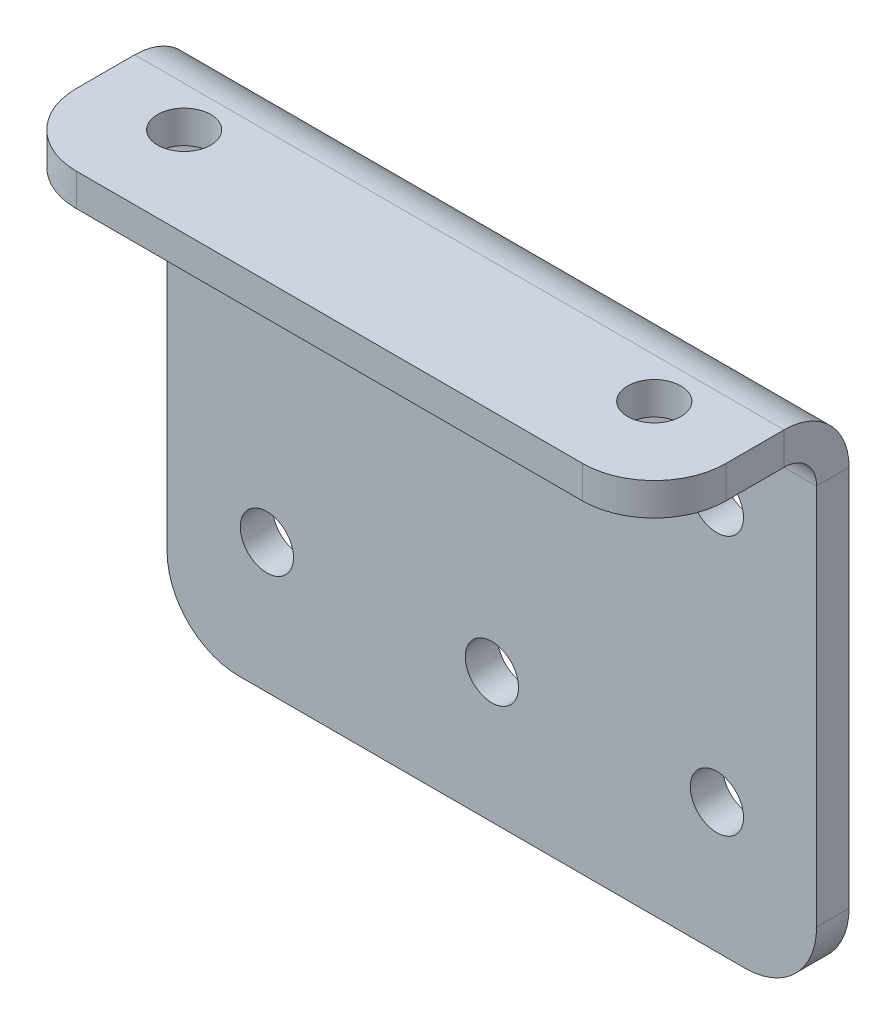
from build123d import *

# Parameters (mm, degrees)
SKETCH2_W              = 63.5
SKETCH2_H              = 50.679996867
BOSS_EXTRUDE1_DEPTH    = 3.175
SKETCH3_W              = 63.5
SKETCH3_H              = 19.05
BOSS_EXTRUDE2_DEPTH    = 3.175
SKETCH4_R              = 2.6
CUT_EXTRUDE1_DEPTH     = 3.175
FILLET1_R              = 7
CONVERT_SOLID1_START   = -457.2
CONVERT_SOLID1_DEPTH   = 63.5
CONVERT_SOLID1_2_DEPTH = 63.5
SKETCH5_R              = 2.6
CUT_EXTRUDE2_DEPTH     = 10


# Read off the part's stored shape, not the designer's step: Convert-Solid1
with BuildPart() as part:
    # Sketch2 → Boss-Extrude1 (new body)
    with BuildSketch(Plane.XY):
        with Locations((-425.45, -0.060001567)):
            Rectangle(SKETCH2_W, SKETCH2_H)
    extrude(amount=BOSS_EXTRUDE1_DEPTH)

    # Sketch3 → Boss-Extrude2 (add)
    with BuildSketch(Plane(origin=(0, 25.279996867, 0), x_dir=(1, 0, 0), z_dir=(0, 1, 0))):
        with Locations((-425.45, -9.525)):
            Rectangle(SKETCH3_W, SKETCH3_H)
    extrude(amount=-BOSS_EXTRUDE2_DEPTH)

    # Sketch4 → Cut-Extrude1 (cut)
    with BuildSketch(Plane.XZ.offset(-22.104996867)):
        with Locations((-402.469029611, 10.280970389)):
            Circle(SKETCH4_R)
        with Locations((-448.430970389, 10.280970389)):
            Circle(SKETCH4_R)
    extrude(amount=-CUT_EXTRUDE1_DEPTH, mode=Mode.SUBTRACT)

    # Fillet1
    fillet1_edges = [part.edges().sort_by_distance(p)[0] for p in [
        (-457.2, 23.692496867, 19.05),
        (-393.7, 23.692496867, 19.05),
        (-393.7, -25.4, 1.5875),
        (-457.2, -25.4, 1.5875),
    ]]
    fillet(fillet1_edges, radius=FILLET1_R)

    # Convert-Solid1 outline → Convert-Solid1 (cut)
    with BuildSketch(Plane.YZ.offset(CONVERT_SOLID1_START)):
        with BuildLine():
            Line((25.279996867, 0), (25.279996867, 6.35))
            ThreePointArc((25.279996867, 6.35), (23.420124928, 1.859871939), (18.929996867, 0))
            Line((18.929996867, 0), (25.279996867, 0))
        make_face()
    extrude(amount=CONVERT_SOLID1_DEPTH, mode=Mode.SUBTRACT)

    # Convert-Solid1 2 outline → Convert-Solid1 2 (add)
    with BuildSketch(Plane.YZ.offset(CONVERT_SOLID1_START)):
        with BuildLine():
            Line((22.104996867, 3.175), (22.104996867, 6.35))
            ThreePointArc((22.104996867, 6.35), (21.175060897, 4.10493597), (18.929996867, 3.175))
            Line((18.929996867, 3.175), (22.104996867, 3.175))
        make_face()
    extrude(amount=CONVERT_SOLID1_2_DEPTH)

    # Sketch5 → Cut-Extrude2 (cut)
    with BuildSketch(Plane.XY.offset(3.175)):
        with Locations((-447.45, 12.7)):
            Circle(SKETCH5_R)
        with Locations((-425.45, 12.7)):
            Circle(SKETCH5_R)
        with Locations((-403.45, 12.7)):
            Circle(SKETCH5_R)
        with Locations((-403.45, -12.7)):
            Circle(SKETCH5_R)
        with Locations((-425.45, -12.7)):
            Circle(SKETCH5_R)
        with Locations((-447.45, -12.7)):
            Circle(SKETCH5_R)
    extrude(amount=-CUT_EXTRUDE2_DEPTH, mode=Mode.SUBTRACT)


solid = part.part
